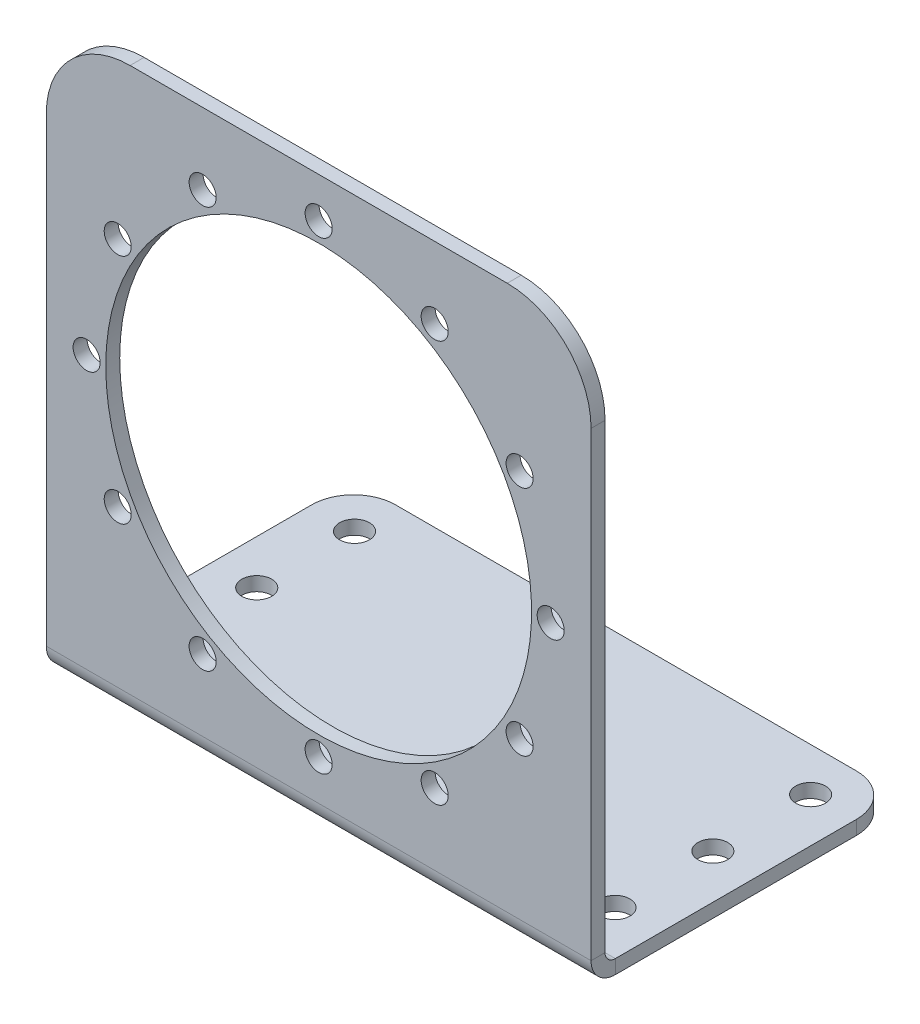
from build123d import *

# Parameters (mm, degrees)
BASE_FLANGE1_DEPTH = 1
EDGE_FLANGE1_DEPTH = 39
FILLET1_R          = 3
SKETCH12_R         = 15.241955925
SKETCH12_R_2       = 0.968487673
CUT_EXTRUDE1_DEPTH = 1
SKETCH13_R         = 1.066611422
CUT_EXTRUDE2_DEPTH = 1


# Sheet-metal steps are written as plain solids
with BuildPart() as part:
    # Sketch2 → Base-Flange1 (new body)
    with BuildSketch(Plane.XY):
        with BuildLine():
            Line((0, 0), (39, 0))
            Line((39, 0), (39, 33))
            ThreePointArc((39, 33), (37.242640687, 37.242640687), (33, 39))
            Line((33, 39), (6, 39))
            ThreePointArc((6, 39), (1.757359313, 37.242640687), (0, 33))
            Line((0, 33), (0, 0))
        make_face()
    extrude(amount=-BASE_FLANGE1_DEPTH)

    # Edge-Flange1 section (across the edge) → Edge-Flange1 (add)
    with BuildSketch(Plane(origin=(39, -0.7366, -1), x_dir=(0, 1, 0), z_dir=(-1, 0, 0))):
        with BuildLine():
            Line((-1, 0.7366), (-1, 21))
            Line((-1, 21), (0, 21))
            Line((0, 21), (0, 0.7366))
            ThreePointArc((0, 0.7366), (0.215745145, 0.215745145), (0.7366, 0))
            Line((0.7366, 0), (0.7366, -1))
            ThreePointArc((0.7366, -1), (-0.491361636, -0.491361636), (-1, 0.7366))
        make_face()
    extrude(amount=EDGE_FLANGE1_DEPTH)

    # Fillet1
    fillet1_edges = [part.edges().sort_by_distance(p)[0] for p in [
        (39, -1.2366, -22),
        (0, -1.2366, -22),
    ]]
    fillet(fillet1_edges, radius=FILLET1_R)

    # Sketch12 → Cut-Extrude1 (cut)
    with BuildSketch(Plane(origin=(0, 0, -1), x_dir=(-1, 0, 0), z_dir=(0, 0, -1))):
        with Locations((-19.5, 19.5)):
            Circle(SKETCH12_R)
        with Locations((-19.5, 36.110428889)):
            Circle(SKETCH12_R_2)
        with Locations((-27.805214445, 33.885053386)):
            Circle(SKETCH12_R_2)
        with Locations((-33.885053386, 27.805214445)):
            Circle(SKETCH12_R_2)
        with Locations((-36.110428889, 19.5)):
            Circle(SKETCH12_R_2)
        with Locations((-33.885053386, 11.194785555)):
            Circle(SKETCH12_R_2)
        with Locations((-27.805214445, 5.114946614)):
            Circle(SKETCH12_R_2)
        with Locations((-19.5, 2.889571111)):
            Circle(SKETCH12_R_2)
        with Locations((-11.194785555, 5.114946614)):
            Circle(SKETCH12_R_2)
        with Locations((-5.114946614, 11.194785555)):
            Circle(SKETCH12_R_2)
        with Locations((-2.889571111, 19.5)):
            Circle(SKETCH12_R_2)
        with Locations((-5.114946614, 27.805214445)):
            Circle(SKETCH12_R_2)
        with Locations((-11.194785555, 33.885053386)):
            Circle(SKETCH12_R_2)
    extrude(amount=-CUT_EXTRUDE1_DEPTH, mode=Mode.SUBTRACT)

    # Sketch13 → Cut-Extrude2 (cut)
    with BuildSketch(Plane(origin=(0, -0.7366, 0), x_dir=(1, 0, 0), z_dir=(0, 1, 0))):
        with Locations(Location((3.175481607, 18.89157203, 0), (0, 0, 270))):
            Circle(SKETCH13_R)
        with Locations(Location((3.175481607, 11.89157203, 0), (0, 0, 270))):
            Circle(SKETCH13_R)
        with Locations(Location((3.175481607, 4.89157203, 0), (0, 0, 270))):
            Circle(SKETCH13_R)
        with Locations(Location((35.824518393, 4.89157203, 0), (0, 0, 90))):
            Circle(SKETCH13_R)
        with Locations(Location((35.824518393, 11.89157203, 0), (0, 0, 90))):
            Circle(SKETCH13_R)
        with Locations(Location((35.824518393, 18.89157203, 0), (0, 0, 90))):
            Circle(SKETCH13_R)
    extrude(amount=-CUT_EXTRUDE2_DEPTH, mode=Mode.SUBTRACT)


solid = part.part
